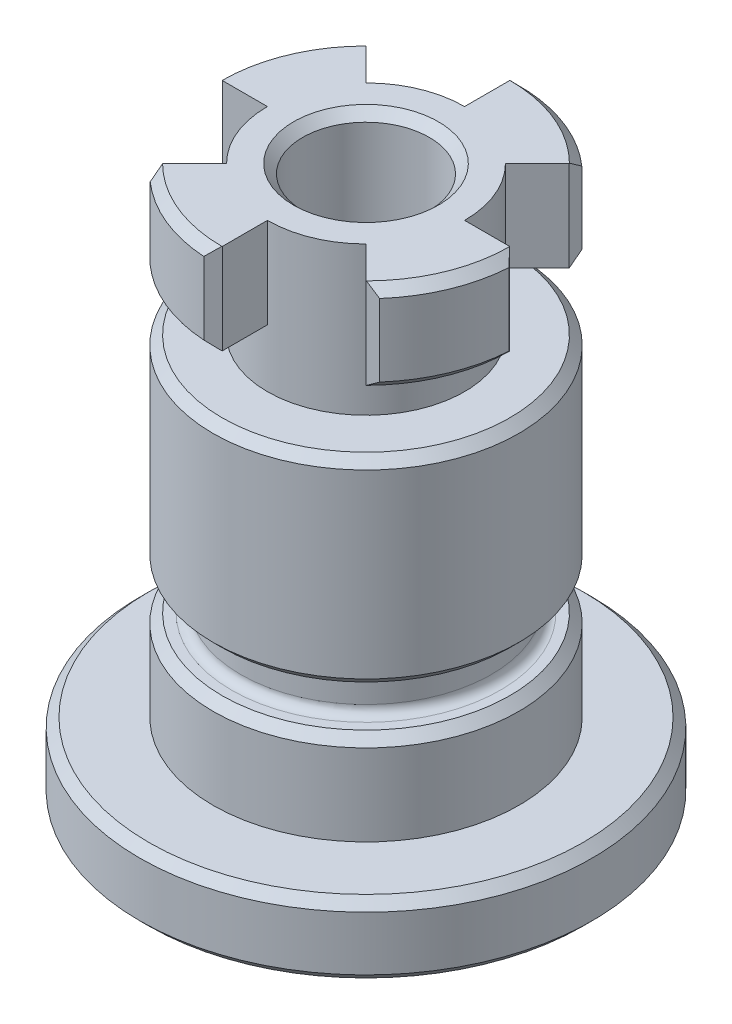
from build123d import *

# Parameters (mm, degrees)
SKETCH1_R           = 12.5
BOSS_EXTRUDE1_DEPTH = 4
SKETCH2_R           = 8.45
BOSS_EXTRUDE2_DEPTH = 5
SKETCH3_R           = 6.925
BOSS_EXTRUDE3_DEPTH = 2.3
SKETCH4_R           = 8.45
BOSS_EXTRUDE4_DEPTH = 11
SKETCH5_R           = 5.45
BOSS_EXTRUDE5_DEPTH = 3.2
SKETCH6_R           = 5.45
BOSS_EXTRUDE7_DEPTH = 5
SKETCH7_R           = 3.5
CUT_EXTRUDE1_DEPTH  = 36.252659474
CHAMFER1_START      = 25.5
CHAMFER1_2_DEPTH    = 5.5
FILLET1_R           = 0.5


with BuildPart() as part:
    # Sketch1 → Boss-Extrude1 (new body)
    with BuildSketch(Plane(origin=(0, 0, 0), x_dir=(1, 0, 0), z_dir=(0, 1, 0))):
        with Locations(Location((0, 0, 0), (0, 0, 270))):
            Circle(SKETCH1_R)
    extrude(amount=BOSS_EXTRUDE1_DEPTH)

    # Sketch2 → Boss-Extrude2 (add)
    with BuildSketch(Plane(origin=(0, 4, 0), x_dir=(1, 0, 0), z_dir=(0, 1, 0))):
        with Locations(Location((0, 0, 0), (0, 0, 270))):
            Circle(SKETCH2_R)
    extrude(amount=BOSS_EXTRUDE2_DEPTH)

    # Sketch3 → Boss-Extrude3 (add)
    with BuildSketch(Plane(origin=(0, 9, 0), x_dir=(1, 0, 0), z_dir=(0, 1, 0))):
        with Locations(Location((0, 0, 0), (0, 0, 270))):
            Circle(SKETCH3_R)
    extrude(amount=BOSS_EXTRUDE3_DEPTH)

    # Sketch4 → Boss-Extrude4 (add)
    with BuildSketch(Plane(origin=(0, 11.3, 0), x_dir=(1, 0, 0), z_dir=(0, 1, 0))):
        with Locations(Location((0, 0, 0), (0, 0, 270))):
            Circle(SKETCH4_R)
    extrude(amount=BOSS_EXTRUDE4_DEPTH)

    # Sketch5 → Boss-Extrude5 (add)
    with BuildSketch(Plane(origin=(0, 22.3, 0), x_dir=(1, 0, 0), z_dir=(0, 1, 0))):
        with Locations(Location((0, 0, 0), (0, 0, 270))):
            Circle(SKETCH5_R)
    extrude(amount=BOSS_EXTRUDE5_DEPTH)

    # Sketch6 → Boss-Extrude7 (add)
    with BuildSketch(Plane(origin=(0, 25.5, 0), x_dir=(1, 0, 0), z_dir=(0, 1, 0))):
        with Locations(Location((0, 0, 0), (0, 0, 270))):
            Circle(SKETCH6_R)
        with BuildLine():
            Line((-8.45, 0), (-5.45, 0))
            ThreePointArc((-5.45, 0), (-5.035143452, 2.085624706), (-3.853731957, 3.853731957))
            Line((-3.853731957, 3.853731957), (-5.975052301, 5.975052301))
            ThreePointArc((-5.975052301, 5.975052301), (-7.80678205, 3.233675003), (-8.45, 0))
        make_face()
        with BuildLine():
            ThreePointArc((0, -5.45), (-2.085624706, -5.035143452), (-3.853731957, -3.853731957))
            Line((-3.853731957, -3.853731957), (-5.975052301, -5.975052301))
            ThreePointArc((-5.975052301, -5.975052301), (-3.233675003, -7.80678205), (0, -8.45))
            Line((0, -8.45), (0, -5.45))
        make_face()
        with BuildLine():
            ThreePointArc((5.45, 0), (5.035143452, -2.085624706), (3.853731957, -3.853731957))
            Line((3.853731957, -3.853731957), (5.975052301, -5.975052301))
            ThreePointArc((5.975052301, -5.975052301), (7.80678205, -3.233675003), (8.45, 0))
            Line((8.45, 0), (5.45, 0))
        make_face()
        with BuildLine():
            Line((0, 8.45), (0, 5.45))
            ThreePointArc((0, 5.45), (2.085624706, 5.035143452), (3.853731957, 3.853731957))
            Line((3.853731957, 3.853731957), (5.975052301, 5.975052301))
            ThreePointArc((5.975052301, 5.975052301), (3.233675003, 7.80678205), (0, 8.45))
        make_face()
    extrude(amount=BOSS_EXTRUDE7_DEPTH)

    # Sketch7 → Cut-Extrude1 (cut, through all)
    with BuildSketch(Plane(origin=(0, 30.5, 0), x_dir=(1, 0, 0), z_dir=(0, 1, 0))):
        with Locations(Location((0, 0, 0), (0, 0, 270))):
            Circle(SKETCH7_R)
    extrude(amount=-CUT_EXTRUDE1_DEPTH, mode=Mode.SUBTRACT)

    # Chamfer1: read off the stored shape, not the designer's step
    # Chamfer1 outline → Chamfer1 (revolve, cut)
    with BuildSketch(Plane.XY):
        Polygon((12.5, 0.5), (12, 0), (12.5, 0), align=None)
        Polygon((12, 4), (12.5, 3.5), (12.5, 4), align=None)
        Polygon((7.95, 9), (8.45, 8.5), (8.45, 9), align=None)
        Polygon((7.95, 11.3), (8.45, 11.3), (8.45, 11.8), align=None)
        Polygon((7.95, 22.3), (8.45, 21.8), (8.45, 22.3), align=None)
        Polygon((7.95, 30.5), (8.45, 30), (8.45, 30.5), align=None)
        Polygon((3.5, 30), (4, 30.5), (3.5, 30.5), align=None)
    revolve(axis=Axis((0, 0, 0), (0, 1, 0)), mode=Mode.SUBTRACT)

    # Chamfer1 2 outline → Chamfer1 2 (cut)
    with BuildSketch(Plane(origin=(0, 0, 0), x_dir=(1, 0, 0), z_dir=(0, 1, 0)).offset(CHAMFER1_START)):
        with BuildLine():
            Line((8.45, 0), (7.93426115, 0))
            Line((7.93426115, 0), (8.433271285, -0.531446541))
            ThreePointArc((8.433271285, -0.531446541), (8.445816786, -0.265854883), (8.45, 0))
        make_face()
        with BuildLine():
            ThreePointArc((5.975052301, -5.975052301), (6.160082112, -5.784106531), (6.339012766, -5.587433861))
            Line((6.339012766, -5.587433861), (5.610369863, -5.610369863))
            Line((5.610369863, -5.610369863), (5.975052301, -5.975052301))
        make_face()
        with BuildLine():
            ThreePointArc((5.975052301, 5.975052301), (5.784106531, 6.160082112), (5.587433861, 6.339012766))
            Line((5.587433861, 6.339012766), (5.610369863, 5.610369863))
            Line((5.610369863, 5.610369863), (5.975052301, 5.975052301))
        make_face()
        with BuildLine():
            Line((0, 7.93426115), (0.531446541, 8.433271285))
            ThreePointArc((0.531446541, 8.433271285), (0.265854883, 8.445816786), (0, 8.45))
            Line((0, 8.45), (0, 7.93426115))
        make_face()
        with BuildLine():
            ThreePointArc((-5.975052301, -5.975052301), (-5.784106531, -6.160082112), (-5.587433861, -6.339012766))
            Line((-5.587433861, -6.339012766), (-5.610369863, -5.610369863))
            Line((-5.610369863, -5.610369863), (-5.975052301, -5.975052301))
        make_face()
        with BuildLine():
            Line((0, -7.93426115), (-0.531446541, -8.433271285))
            ThreePointArc((-0.531446541, -8.433271285), (-0.265854883, -8.445816786), (0, -8.45))
            Line((0, -8.45), (0, -7.93426115))
        make_face()
        with BuildLine():
            ThreePointArc((-5.975052301, 5.975052301), (-6.160082112, 5.784106531), (-6.339012766, 5.587433861))
            Line((-6.339012766, 5.587433861), (-5.610369863, 5.610369863))
            Line((-5.610369863, 5.610369863), (-5.975052301, 5.975052301))
        make_face()
        with BuildLine():
            Line((-7.93426115, 0), (-8.433271285, 0.531446541))
            ThreePointArc((-8.433271285, 0.531446541), (-8.445816786, 0.265854883), (-8.45, 0))
            Line((-8.45, 0), (-7.93426115, 0))
        make_face()
    extrude(amount=CHAMFER1_2_DEPTH, mode=Mode.SUBTRACT)

    # Chamfer1 3 outline → Chamfer1 3 (revolve, cut)
    with BuildSketch(Plane.XY):
        Polygon((8.45, 26), (7.95, 25.5), (8.45, 25.5), align=None)
    revolve(axis=Axis((0, 0, 0), (0, 1, 0)), mode=Mode.SUBTRACT)

    # Fillet1
    fillet1_edges = [part.edges().sort_by_distance(p)[0] for p in [
        (0, 11.3, -6.925),
        (0, 9, -6.925),
    ]]
    fillet(fillet1_edges, radius=FILLET1_R)


solid = part.part
